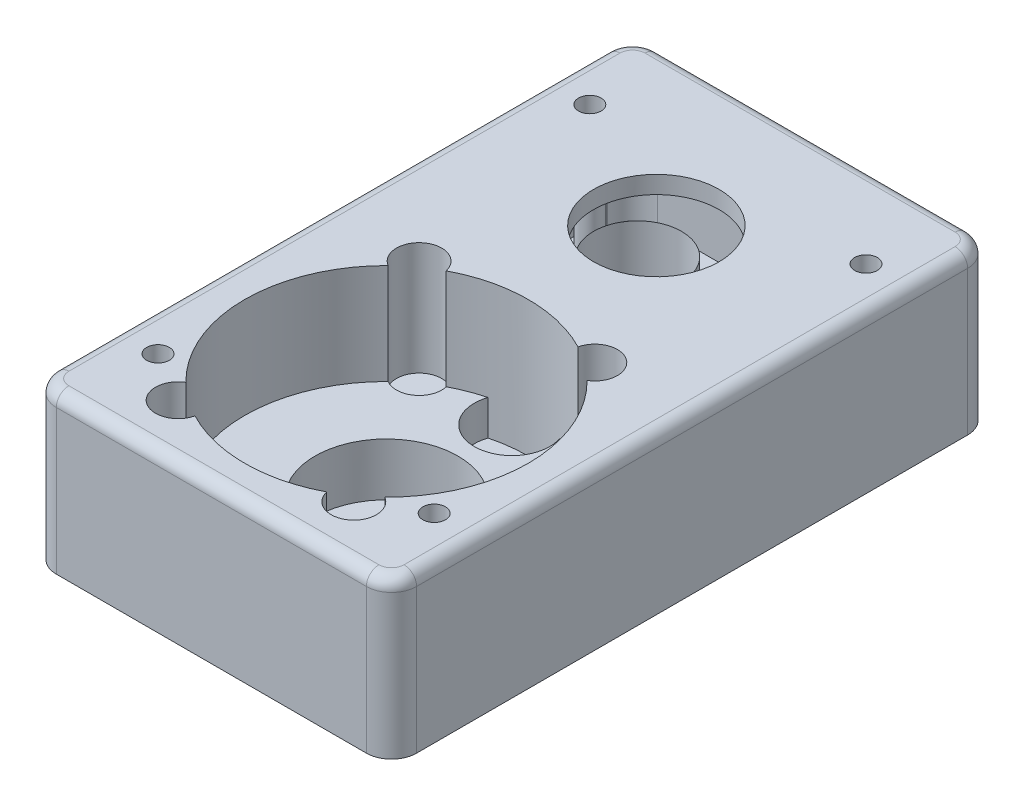
from build123d import *

# Parameters (mm, degrees)
SKETCH1_W           = 36.449
SKETCH1_H           = 60.833
BOSS_EXTRUDE1_DEPTH = 15.875
CAVITY1_START       = 5.715
CAVITY1_OUTLINE_R   = 4.445
CAVITY1_DEPTH       = 10.16
CAVITY1_START_2     = 0.381
CAVITY1_2_OUTLINE_R = 7.239
CAVITY1_2_DEPTH     = 5.334
CAVITY1_START_3     = 2.667
CAVITY1_3_OUTLINE_R = 4.445
CAVITY1_3_DEPTH     = 3.048
CAVITY1_START_4     = 14.097
CAVITY1_4_DEPTH     = 1.778
CAVITY1_START_5     = 4.445
CAVITY1_5_OUTLINE_R = 2.286
CAVITY1_5_DEPTH     = 1.27
CAVITY1_START_6     = 2.159
CAVITY1_6_DEPTH     = 0.508
FILLET1_R           = 2.54
SKETCH5_R           = 1.905
SKETCH5_R_2         = 1.985019455
CUT_EXTRUDE1_DEPTH  = 9.525
FILLET2_R           = 1.27


# Read off the part's stored shape, not the designer's step: Cavity1
with BuildPart() as part:
    # Sketch1 → Boss-Extrude1 (new body)
    with BuildSketch(Plane(origin=(0, 0, 0), x_dir=(1, 0, 0), z_dir=(0, 1, 0))):
        Rectangle(SKETCH1_W, SKETCH1_H)
    extrude(amount=BOSS_EXTRUDE1_DEPTH)

    # Cavity1 outline → Cavity1 (cut)
    with BuildSketch(Plane(origin=(0, 0, 0), x_dir=(1, 0, 0), z_dir=(0, 1, 0)).offset(CAVITY1_START)):
        with BuildLine():
            ThreePointArc((6.663505747, 0.010188518), (0, 1.651), (-6.663505747, 0.010188518))
            ThreePointArc((-6.663505747, 0.010188518), (-10.236847552, 1.339105214), (-10.064128852, -2.469432496))
            ThreePointArc((-10.064128852, -2.469432496), (-14.351, -12.7), (-10.064128852, -22.930567504))
            ThreePointArc((-10.064128852, -22.930567504), (-10.236847552, -26.739105214), (-6.663505747, -25.410188518))
            ThreePointArc((-6.663505747, -25.410188518), (0, -27.051), (6.663505747, -25.410188518))
            ThreePointArc((6.663505747, -25.410188518), (10.236847552, -26.739105214), (10.064128852, -22.930567504))
            ThreePointArc((10.064128852, -22.930567504), (14.351, -12.7), (10.064128852, -2.469432496))
            ThreePointArc((10.064128852, -2.469432496), (10.236847552, 1.339105214), (6.663505747, 0.010188518))
        make_face()
        with Locations((0, 12.7)):
            Circle(CAVITY1_OUTLINE_R)
    extrude(amount=CAVITY1_DEPTH, mode=Mode.SUBTRACT)

    # Cavity1 2 outline → Cavity1 2 (cut)
    with BuildSketch(Plane(origin=(0, 0, 0), x_dir=(1, 0, 0), z_dir=(0, 1, 0)).offset(CAVITY1_START_2)):
        with Locations((0, -12.7)):
            Circle(CAVITY1_2_OUTLINE_R)
    extrude(amount=CAVITY1_2_DEPTH, mode=Mode.SUBTRACT)

    # Cavity1 3 outline → Cavity1 3 (cut)
    with BuildSketch(Plane(origin=(0, 0, 0), x_dir=(1, 0, 0), z_dir=(0, 1, 0)).offset(CAVITY1_START_3)):
        with BuildLine():
            ThreePointArc((3.62043784, 1.186815), (0, 1.651), (-3.62043784, 1.186815))
            ThreePointArc((-3.62043784, 1.186815), (0, -3.81), (3.62043784, 1.186815))
        make_face()
        with Locations((0, 12.7)):
            Circle(CAVITY1_3_OUTLINE_R)
    extrude(amount=CAVITY1_3_DEPTH, mode=Mode.SUBTRACT)

    # Cavity1 4 outline → Cavity1 4 (cut)
    with BuildSketch(Plane(origin=(0, 0, 0), x_dir=(1, 0, 0), z_dir=(0, 1, 0)).offset(CAVITY1_START_4)):
        with BuildLine():
            Line((-1.245086436, 8.432941907), (-1.261900971, 8.381648336))
            ThreePointArc((-1.261900971, 8.381648336), (-1.083049158, 8.34804351), (-0.903307825, 8.319577582))
            Line((-0.903307825, 8.319577582), (-0.939813075, 8.355488936))
            ThreePointArc((-0.939813075, 8.355488936), (-1.093135951, 8.391510846), (-1.245086436, 8.432941907))
        make_face()
        with BuildLine():
            ThreePointArc((-6.269761763, 13.598725967), (-4.581043619, 10.20766679), (-1.261900971, 8.381648336))
            Line((-1.261900971, 8.381648336), (-1.245086436, 8.432941907))
            ThreePointArc((-1.245086436, 8.432941907), (-3.227510815, 9.643662496), (-4.32851275, 11.689058668))
            Line((-4.32851275, 11.689058668), (-6.269761763, 13.598725967))
        make_face()
        with BuildLine():
            Line((1.245086436, 8.432941907), (1.261900971, 8.381648336))
            ThreePointArc((1.261900971, 8.381648336), (4.581043619, 10.20766679), (6.269761763, 13.598725967))
            Line((6.269761763, 13.598725967), (4.32851275, 11.689058668))
            ThreePointArc((4.32851275, 11.689058668), (3.227510815, 9.643662496), (1.245086436, 8.432941907))
        make_face()
        with BuildLine():
            ThreePointArc((0.903307825, 8.319577582), (1.083049158, 8.34804351), (1.261900971, 8.381648336))
            Line((1.261900971, 8.381648336), (1.245086436, 8.432941907))
            ThreePointArc((1.245086436, 8.432941907), (1.093135951, 8.391510846), (0.939813075, 8.355488936))
            Line((0.939813075, 8.355488936), (0.903307825, 8.319577582))
        make_face()
        with BuildLine():
            ThreePointArc((-2.667234262, 20.367669641), (-5.605544051, 17.588349777), (-6.269761763, 13.598725967))
            Line((-6.269761763, 13.598725967), (-4.32851275, 11.689058668))
            ThreePointArc((-4.32851275, 11.689058668), (-3.909642573, 14.8148806), (-1.522653339, 16.876068942))
            Line((-1.522653339, 16.876068942), (-2.667234262, 20.367669641))
        make_face()
        with BuildLine():
            Line((-0.939813075, 8.355488936), (-0.903307825, 8.319577582))
            ThreePointArc((-0.903307825, 8.319577582), (-0.452806615, 8.271164971), (-1.8e-08, 8.255))
            ThreePointArc((-1.8e-08, 8.255), (-0.472585091, 8.280193632), (-0.939813075, 8.355488936))
        make_face()
        with BuildLine():
            ThreePointArc((-1.8e-08, 8.255), (0.452806598, 8.27116497), (0.903307825, 8.319577582))
            Line((0.903307825, 8.319577582), (0.939813075, 8.355488936))
            ThreePointArc((0.939813075, 8.355488936), (0.472585074, 8.28019363), (-1.8e-08, 8.255))
        make_face()
        with BuildLine():
            Line((4.32851275, 11.689058668), (6.269761763, 13.598725967))
            ThreePointArc((6.269761763, 13.598725967), (6.329908656, 14.100266009), (6.35, 14.605))
            ThreePointArc((6.35, 14.605), (5.35067461, 18.024470897), (2.667234262, 20.367669641))
            Line((2.667234262, 20.367669641), (1.522653339, 16.876068942))
            ThreePointArc((1.522653339, 16.876068942), (3.641855234, 15.2485124), (4.445, 12.7))
            ThreePointArc((4.445, 12.7), (4.41578216, 12.191184794), (4.32851275, 11.689058668))
        make_face()
        with BuildLine():
            ThreePointArc((2.667234262, 20.367669641), (0, 20.955), (-2.667234262, 20.367669641))
            Line((-2.667234262, 20.367669641), (-1.522653339, 16.876068942))
            ThreePointArc((-1.522653339, 16.876068942), (0, 17.145), (1.522653339, 16.876068942))
            Line((1.522653339, 16.876068942), (2.667234262, 20.367669641))
        make_face()
    extrude(amount=CAVITY1_4_DEPTH, mode=Mode.SUBTRACT)

    # Cavity1 5 outline → Cavity1 5 (cut)
    with BuildSketch(Plane(origin=(0, 0, 0), x_dir=(1, 0, 0), z_dir=(0, 1, 0)).offset(CAVITY1_START_5)):
        with Locations((-8.89, -0.508)):
            Circle(CAVITY1_5_OUTLINE_R)
        with Locations((8.89, -0.508)):
            Circle(CAVITY1_5_OUTLINE_R)
        with Locations((8.89, -24.892)):
            Circle(CAVITY1_5_OUTLINE_R)
        with Locations((-8.89, -24.892)):
            Circle(CAVITY1_5_OUTLINE_R)
    extrude(amount=CAVITY1_5_DEPTH, mode=Mode.SUBTRACT)

    # Cavity1 6 outline → Cavity1 6 (cut)
    with BuildSketch(Plane(origin=(0, 0, 0), x_dir=(1, 0, 0), z_dir=(0, 1, 0)).offset(CAVITY1_START_6)):
        with BuildLine():
            ThreePointArc((3.62043784, 1.186815), (0, 1.651), (-3.62043784, 1.186815))
            ThreePointArc((-3.62043784, 1.186815), (0, -3.81), (3.62043784, 1.186815))
        make_face()
    extrude(amount=CAVITY1_6_DEPTH, mode=Mode.SUBTRACT)

    # Cavity1 7 outline → Cavity1 7 (revolve, cut)
    with BuildSketch(Plane(origin=(13.97, 0, 21.844), x_dir=(1, 0, 0), z_dir=(0, 0, 1))):
        with BuildLine():
            Line((0, 0), (1.905, 0))
            Line((1.905, 0), (1.905, 2.889885254))
            ThreePointArc((1.905, 2.889885254), (1.683631265, 3.439811386), (1.143, 3.683))
            Line((1.143, 3.683), (1.143, 15.875))
            Line((1.143, 15.875), (0, 15.875))
            Line((0, 15.875), (0, 0))
        make_face()
    revolve(axis=Axis((13.97, 0, 21.844), (0, 1, 0)), mode=Mode.SUBTRACT)

    # Cavity1 8 outline → Cavity1 8 (revolve, cut)
    with BuildSketch(Plane(origin=(-13.97, 0, 21.844), x_dir=(1, 0, 0), z_dir=(0, 0, 1))):
        with BuildLine():
            Line((0, 0), (1.905, 0))
            Line((1.905, 0), (1.905, 2.889885254))
            ThreePointArc((1.905, 2.889885254), (1.683631265, 3.439811386), (1.143, 3.683))
            Line((1.143, 3.683), (1.143, 15.875))
            Line((1.143, 15.875), (0, 15.875))
            Line((0, 15.875), (0, 0))
        make_face()
    revolve(axis=Axis((-13.97, 0, 21.844), (0, 1, 0)), mode=Mode.SUBTRACT)

    # Cavity1 9 outline → Cavity1 9 (revolve, cut)
    with BuildSketch(Plane(origin=(-13.97, 0, -21.844), x_dir=(1, 0, 0), z_dir=(0, 0, 1))):
        with BuildLine():
            Line((0, 0), (1.905, 0))
            Line((1.905, 0), (1.905, 2.889885254))
            ThreePointArc((1.905, 2.889885254), (1.683631265, 3.439811386), (1.143, 3.683))
            Line((1.143, 3.683), (1.143, 15.875))
            Line((1.143, 15.875), (0, 15.875))
            Line((0, 15.875), (0, 0))
        make_face()
    revolve(axis=Axis((-13.97, 0, -21.844), (0, 1, 0)), mode=Mode.SUBTRACT)

    # Cavity1 10 outline → Cavity1 10 (revolve, cut)
    with BuildSketch(Plane(origin=(13.97, 0, -21.844), x_dir=(1, 0, 0), z_dir=(0, 0, 1))):
        with BuildLine():
            Line((0, 0), (1.905, 0))
            Line((1.905, 0), (1.905, 2.889885254))
            ThreePointArc((1.905, 2.889885254), (1.683631265, 3.439811386), (1.143, 3.683))
            Line((1.143, 3.683), (1.143, 15.875))
            Line((1.143, 15.875), (0, 15.875))
            Line((0, 15.875), (0, 0))
        make_face()
    revolve(axis=Axis((13.97, 0, -21.844), (0, 1, 0)), mode=Mode.SUBTRACT)

    # Fillet1
    fillet1_edges = [part.edges().sort_by_distance(p)[0] for p in [
        (18.2245, 7.9375, 30.4165),
        (-18.2245, 7.9375, 30.4165),
        (-18.2245, 7.9375, -30.4165),
        (18.2245, 7.9375, -30.4165),
    ]]
    fillet(fillet1_edges, radius=FILLET1_R)

    # Sketch5 → Cut-Extrude1 (cut)
    with BuildSketch(Plane.XZ):
        with Locations(Location((-14.732, 26.924, 0), (0, 0, 270))):
            Circle(SKETCH5_R)
        with Locations(Location((14.732, -26.924, 0), (0, 0, 270))):
            Circle(SKETCH5_R_2)
    extrude(amount=-CUT_EXTRUDE1_DEPTH, mode=Mode.SUBTRACT)

    # Fillet2
    fillet2_edges = [part.edges().sort_by_distance(p)[0] for p in [
        (-18.2245, 15.875, 0),
        (0, 15.875, -30.4165),
        (18.2245, 15.875, 0),
        (0, 15.875, 30.4165),
        (-17.480551224, 15.875, 29.672551224),
        (17.480551224, 15.875, 29.672551224),
        (17.480551224, 15.875, -29.672551224),
        (-17.480551224, 15.875, -29.672551224),
    ]]
    fillet(fillet2_edges, radius=FILLET2_R)


solid = part.part
